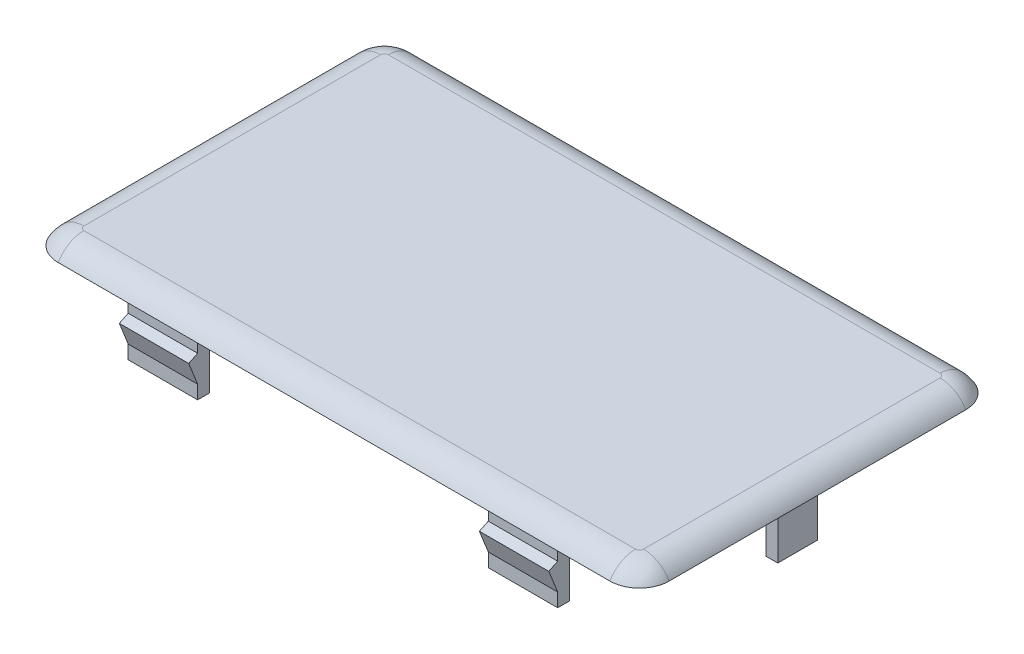
from build123d import *

# Parameters (mm, degrees)
BOSS_EXTRUDE1_DEPTH  = 2.5
FILLET1_R            = 5
BOSS_EXTRUDE2_DEPTH  = 9.8
CUT_EXTRUDE1_DEPTH   = 9.8
CUT_EXTRUDE2_DEPTH   = 89.657557489
BOSS_EXTRUDE3_DEPTH  = 11.7
MIRROR4_COPY_1_DEPTH = 11.7


with BuildPart() as part:
    # Sketch1 → Boss-Extrude1 (new body)
    with BuildSketch(Plane(origin=(0, 0, 0), x_dir=(1, 0, 0), z_dir=(0, 1, 0))):
        with BuildLine():
            Line((-46.5, 30), (46.5, 30))
            ThreePointArc((46.5, 30), (50.035533906, 28.535533906), (51.5, 25))
            Line((51.5, 25), (51.5, -25))
            ThreePointArc((51.5, -25), (50.035533906, -28.535533906), (46.5, -30))
            Line((46.5, -30), (-46.5, -30))
            ThreePointArc((-46.5, -30), (-50.035533906, -28.535533906), (-51.5, -25))
            Line((-51.5, -25), (-51.5, 25))
            ThreePointArc((-51.5, 25), (-50.035533906, 28.535533906), (-46.5, 30))
        make_face()
    extrude(amount=BOSS_EXTRUDE1_DEPTH)

    # Fillet1
    # the kernel refuses this fillet: 5 mm, written as the material it takes off along each edge
    with BuildSketch(Plane(origin=(-46.5, 2.5, -25), x_dir=(-1, 0, 0), z_dir=(0, 0, 1))) as fillet1_piece_1:
        with BuildLine():
            CenterArc((0.669872981, 5), FILLET1_R, 270, 60)
            Line((0.669872981, 0), (0.669872981, -0.1))
            Line((0.669872981, -0.1), (5, -0.1))
            Line((5, -0.1), (5.1, 0))
            ThreePointArc((5.1, 0), (5.1, 1.25), (5.08660254, 2.45))
            Line((5.08660254, 2.45), (5, 2.5))
        make_face()
    revolve(axis=Axis((-46.5, 2.5, -25), (0, -1, 0)), revolution_arc=90, mode=Mode.SUBTRACT)
    with BuildSketch(Plane(origin=(-46.5, 2.5, -30), x_dir=(0, -1, 0), z_dir=(1, 0, 0)), Plane(origin=(46.5, 2.5, 30), x_dir=(0, -1, 0), z_dir=(-1, 0, 0))) as fillet1_piece_2:
        with BuildLine():
            CenterArc((5, -4.330127019), FILLET1_R, 120, 60)
            Line((0, -4.330127019), (-0.1, -4.330127019))
            Line((-0.1, -4.330127019), (-0.1, 0))
            Line((-0.1, 0), (0, 0.1))
            ThreePointArc((0, 0.1), (1.25, 0.1), (2.45, 0.08660254))
            Line((2.45, 0.08660254), (2.5, 0))
        make_face()
    extrude(amount=93, mode=Mode.SUBTRACT)
    with BuildSketch(Plane(origin=(46.5, 2.5, -25), x_dir=(0, 0, -1), z_dir=(-1, 0, 0))) as fillet1_piece_3:
        with BuildLine():
            CenterArc((0.669872981, 5), FILLET1_R, 270, 60)
            Line((0.669872981, 0), (0.669872981, -0.1))
            Line((0.669872981, -0.1), (5, -0.1))
            Line((5, -0.1), (5.1, 0))
            ThreePointArc((5.1, 0), (5.1, 1.25), (5.08660254, 2.45))
            Line((5.08660254, 2.45), (5, 2.5))
        make_face()
    revolve(axis=Axis((46.5, 2.5, -25), (0, -1, 0)), revolution_arc=90, mode=Mode.SUBTRACT)
    with BuildSketch(Plane(origin=(51.5, 2.5, -25), x_dir=(0, -1, 0), z_dir=(0, 0, 1)), Plane(origin=(-51.5, 2.5, 25), x_dir=(0, -1, 0), z_dir=(0, 0, -1))) as fillet1_piece_4:
        with BuildLine():
            CenterArc((5, -4.330127019), FILLET1_R, 120, 60)
            Line((0, -4.330127019), (-0.1, -4.330127019))
            Line((-0.1, -4.330127019), (-0.1, 0))
            Line((-0.1, 0), (0, 0.1))
            ThreePointArc((0, 0.1), (1.25, 0.1), (2.45, 0.08660254))
            Line((2.45, 0.08660254), (2.5, 0))
        make_face()
    extrude(amount=50, mode=Mode.SUBTRACT)
    with BuildSketch(Plane(origin=(46.5, 2.5, 25), x_dir=(1, 0, 0), z_dir=(0, 0, -1))) as fillet1_piece_5:
        with BuildLine():
            CenterArc((0.669872981, 5), FILLET1_R, 270, 60)
            Line((0.669872981, 0), (0.669872981, -0.1))
            Line((0.669872981, -0.1), (5, -0.1))
            Line((5, -0.1), (5.1, 0))
            ThreePointArc((5.1, 0), (5.1, 1.25), (5.08660254, 2.45))
            Line((5.08660254, 2.45), (5, 2.5))
        make_face()
    revolve(axis=Axis((46.5, 2.5, 25), (0, -1, 0)), revolution_arc=90, mode=Mode.SUBTRACT)
    with BuildSketch(Plane(origin=(-46.5, 2.5, 25), x_dir=(0, 0, 1), z_dir=(1, 0, 0))) as fillet1_piece_6:
        with BuildLine():
            CenterArc((0.669872981, 5), FILLET1_R, 270, 60)
            Line((0.669872981, 0), (0.669872981, -0.1))
            Line((0.669872981, -0.1), (5, -0.1))
            Line((5, -0.1), (5.1, 0))
            ThreePointArc((5.1, 0), (5.1, 1.25), (5.08660254, 2.45))
            Line((5.08660254, 2.45), (5, 2.5))
        make_face()
    revolve(axis=Axis((-46.5, 2.5, 25), (0, -1, 0)), revolution_arc=90, mode=Mode.SUBTRACT)

    # Sketch2 → Boss-Extrude2 (add)
    with BuildSketch(Plane.XZ):
        Polygon((-36.2, 28.5), (-24.5, 28.5), (-24.5, 26.5), (-29.35, 26.5), (-29.35, 20.5), (-31.35, 20.5), (-31.35, 26.5), (-36.2, 26.5), align=None)
        Polygon((48.225, -3.282847821), (46.225, -3.282847821), (46.225, -0.999790058), (40.225, -0.999790058), (40.225, 1), (46.225, 1), (46.225, 3.417152179), (48.225, 3.417152179), align=None)
        Polygon((24.5, 28.5), (36.2, 28.5), (36.2, 26.5), (31.35, 26.5), (31.35, 20.5), (29.35, 20.5), (29.35, 26.5), (24.5, 26.5), align=None)
        Polygon((24.5, -26.5), (29.35, -26.5), (29.35, -20.5), (31.35, -20.5), (31.35, -26.5), (36.2, -26.5), (36.2, -28.5), (24.5, -28.5), align=None)
        Polygon((-36.2, -28.5), (-24.5, -28.5), (-24.5, -26.5), (-29.35, -26.5), (-29.35, -20.5), (-31.35, -20.5), (-31.35, -26.5), (-36.2, -26.5), align=None)
        Polygon((-48.225, 3.417152179), (-46.225, 3.417152179), (-46.225, 1), (-40.225, 1), (-40.225, -0.999790058), (-46.225, -0.999790058), (-46.225, -3.282847821), (-48.225, -3.282847821), align=None)
    extrude(amount=BOSS_EXTRUDE2_DEPTH)

    # Sketch4 → Cut-Extrude1 (cut)
    with BuildSketch(Plane(origin=(0, 0, -0.999790058), x_dir=(-1, 0, 0), z_dir=(0, 0, -1))):
        Polygon((40.225, 0), (46.225, -9.8), (40.225, -9.8), align=None)
    cut_extrude1 = extrude(amount=-CUT_EXTRUDE1_DEPTH, mode=Mode.SUBTRACT)

    # Mirror1: Cut-Extrude1 across plane
    add(cut_extrude1.mirror(Plane(origin=(0, 0, 0), x_dir=(0, 0, 1), z_dir=(1, 0, 0))), mode=Mode.SUBTRACT)

    # Sketch5 → Cut-Extrude2 (cut, through all)
    with BuildSketch(Plane.ZY.offset(31.35)):
        Polygon((-26.5, -9.8), (-20.5, 0), (-20.5, -9.8), align=None)
    cut_extrude2 = extrude(amount=-CUT_EXTRUDE2_DEPTH, mode=Mode.SUBTRACT)

    # Mirror2: Cut-Extrude2 across plane
    add(cut_extrude2.mirror(Plane.XY), mode=Mode.SUBTRACT)

    # Sketch6 → Boss-Extrude3 (add)
    with BuildSketch(Plane(origin=(36.2, 0, 0), x_dir=(0, 0, -1), z_dir=(1, 0, 0))):
        Polygon((-28.5, -3), (-28.5, -7.5), (-30, -3.726144837), align=None)
    boss_extrude3 = extrude(amount=-BOSS_EXTRUDE3_DEPTH)

    # Mirror3: Boss-Extrude3 across plane
    add(boss_extrude3.mirror(Plane(origin=(0, 0, 0), x_dir=(0, 0, 1), z_dir=(1, 0, 0))))

    # Mirror4: Boss-Extrude3 across plane
    add(boss_extrude3.mirror(Plane.XY))

    # Mirror4 copy 1 sketch → Mirror4 copy 1 (add)
    with BuildSketch(Plane.ZY.offset(36.2)):
        Polygon((-28.5, -3), (-28.5, -7.5), (-30, -3.726144837), align=None)
    extrude(amount=-MIRROR4_COPY_1_DEPTH)


solid = part.part
